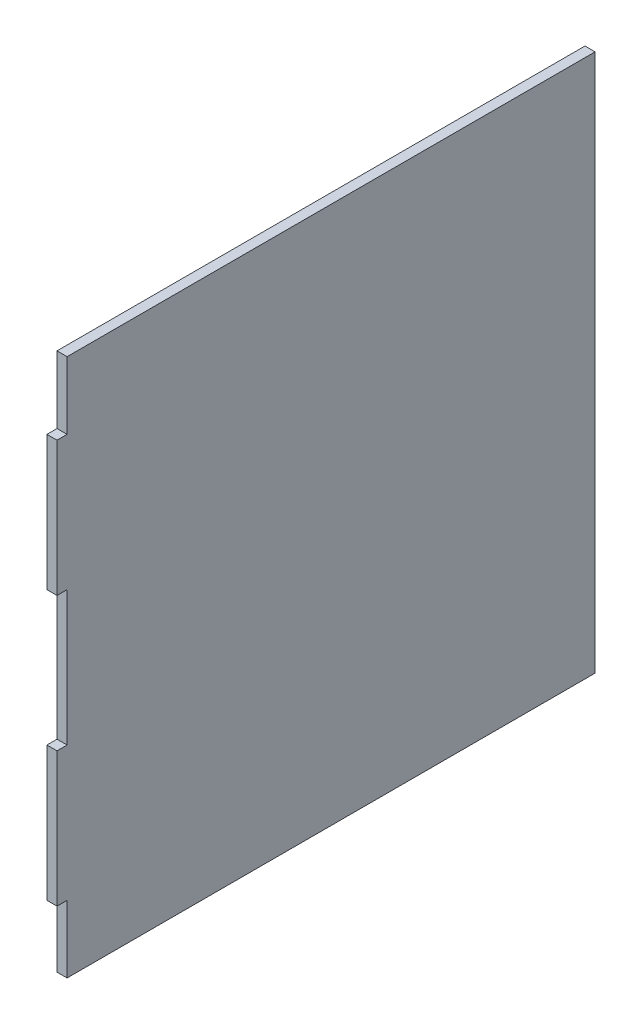
from build123d import *

# Parameters (mm, degrees)
SKETCH1_W           = 160
SKETCH1_H           = 160
BOSS_EXTRUDE1_DEPTH = 3
SKETCH2_W           = 3
SKETCH2_H           = 20
SKETCH2_H_2         = 40
CUT_EXTRUDE1_DEPTH  = 114.176852757


with BuildPart() as part:
    # Sketch1 → Boss-Extrude1 (new body)
    with BuildSketch(Plane(origin=(0, 0, 0), x_dir=(0, 0, -1), z_dir=(1, 0, 0))):
        Rectangle(SKETCH1_W, SKETCH1_H)
    extrude(amount=BOSS_EXTRUDE1_DEPTH)

    # Sketch2 → Cut-Extrude1 (cut, through all)
    with BuildSketch(Plane(origin=(3, 0, 0), x_dir=(0, 0, -1), z_dir=(1, 0, 0))):
        with Locations((-78.5, -70)):
            Rectangle(SKETCH2_W, SKETCH2_H)
        with Locations((-78.5, 0)):
            Rectangle(SKETCH2_W, SKETCH2_H_2)
        with Locations((-78.5, 70)):
            Rectangle(SKETCH2_W, SKETCH2_H)
    extrude(amount=-CUT_EXTRUDE1_DEPTH, mode=Mode.SUBTRACT)


solid = part.part
